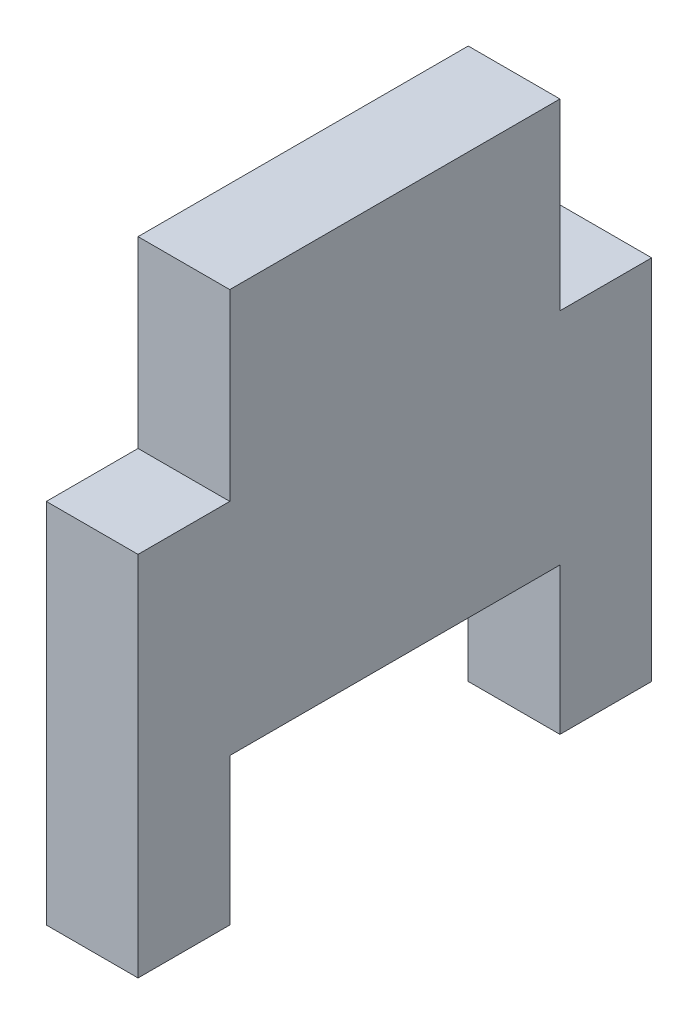
from build123d import *

# Parameters (mm, degrees)
BOSS_EXTRUDE1_DEPTH = 6.35


with BuildPart() as part:
    # Sketch1 → Boss-Extrude1 (new body)
    with BuildSketch(Plane(origin=(0, 0, 0), x_dir=(0, 0, -1), z_dir=(1, 0, 0))):
        Polygon((11.43, 12.7), (-11.43, 12.7), (-11.43, 0), (-17.78, 0), (-17.78, -25.4), (-11.43, -25.4), (-11.43, -15.24), (11.43, -15.24), (11.43, -25.4), (17.78, -25.4), (17.78, 0), (11.43, 0), align=None)
    extrude(amount=BOSS_EXTRUDE1_DEPTH)


solid = part.part
